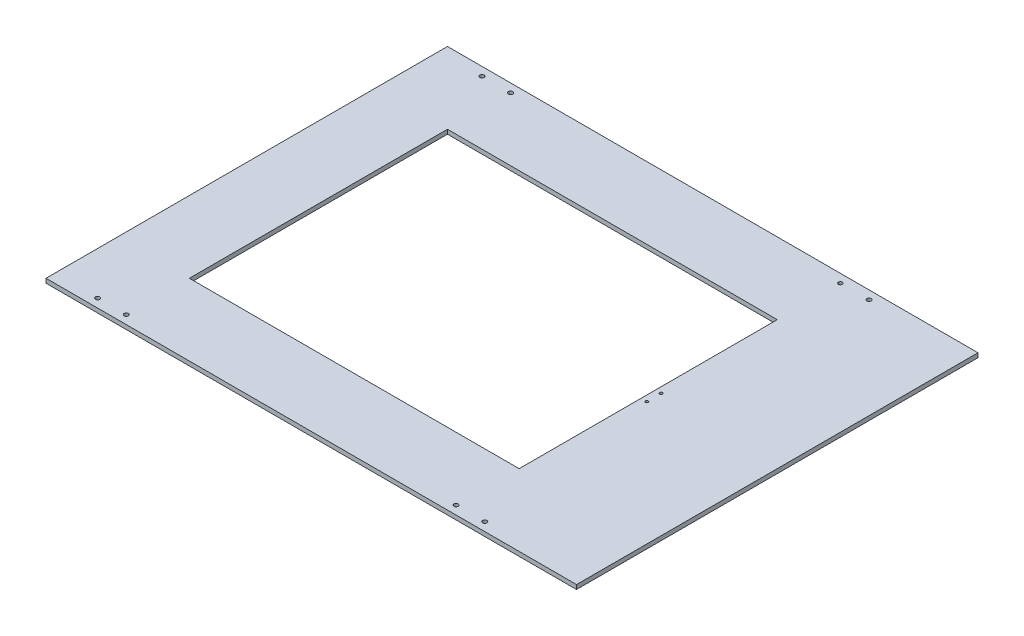
from build123d import *

# Parameters (mm, degrees)
SKETCH1_W           = 370
SKETCH1_H           = 280
SKETCH1_R           = 1.5
SKETCH1_R_2         = 1.569181713
SKETCH1_R_3         = 1.357318829
SKETCH1_R_4         = 1
SKETCH1_W_2         = 230
SKETCH1_H_2         = 180
BOSS_EXTRUDE1_DEPTH = 3


with BuildPart() as part:
    # Sketch1 → Boss-Extrude1 (new body)
    with BuildSketch(Plane(origin=(0, 0, 0), x_dir=(1, 0, 0), z_dir=(0, 1, 0))):
        with Locations((185, 140)):
            Rectangle(SKETCH1_W, SKETCH1_H)
        with Locations((30, 274)):
            Circle(SKETCH1_R, mode=Mode.SUBTRACT)
        with Locations((50, 274)):
            Circle(SKETCH1_R_2, mode=Mode.SUBTRACT)
        with Locations((30, 6)):
            Circle(SKETCH1_R, mode=Mode.SUBTRACT)
        with Locations((50, 6)):
            Circle(SKETCH1_R, mode=Mode.SUBTRACT)
        with Locations((280, 274)):
            Circle(SKETCH1_R_3, mode=Mode.SUBTRACT)
        with Locations((300, 274)):
            Circle(SKETCH1_R, mode=Mode.SUBTRACT)
        with Locations((280, 6)):
            Circle(SKETCH1_R, mode=Mode.SUBTRACT)
        with Locations((300, 6)):
            Circle(SKETCH1_R, mode=Mode.SUBTRACT)
        with Locations((284, 145)):
            Circle(SKETCH1_R_4, mode=Mode.SUBTRACT)
        with Locations((284, 135)):
            Circle(SKETCH1_R_4, mode=Mode.SUBTRACT)
        with Locations((165, 140)):
            Rectangle(SKETCH1_W_2, SKETCH1_H_2, mode=Mode.SUBTRACT)
    extrude(amount=BOSS_EXTRUDE1_DEPTH)


solid = part.part
